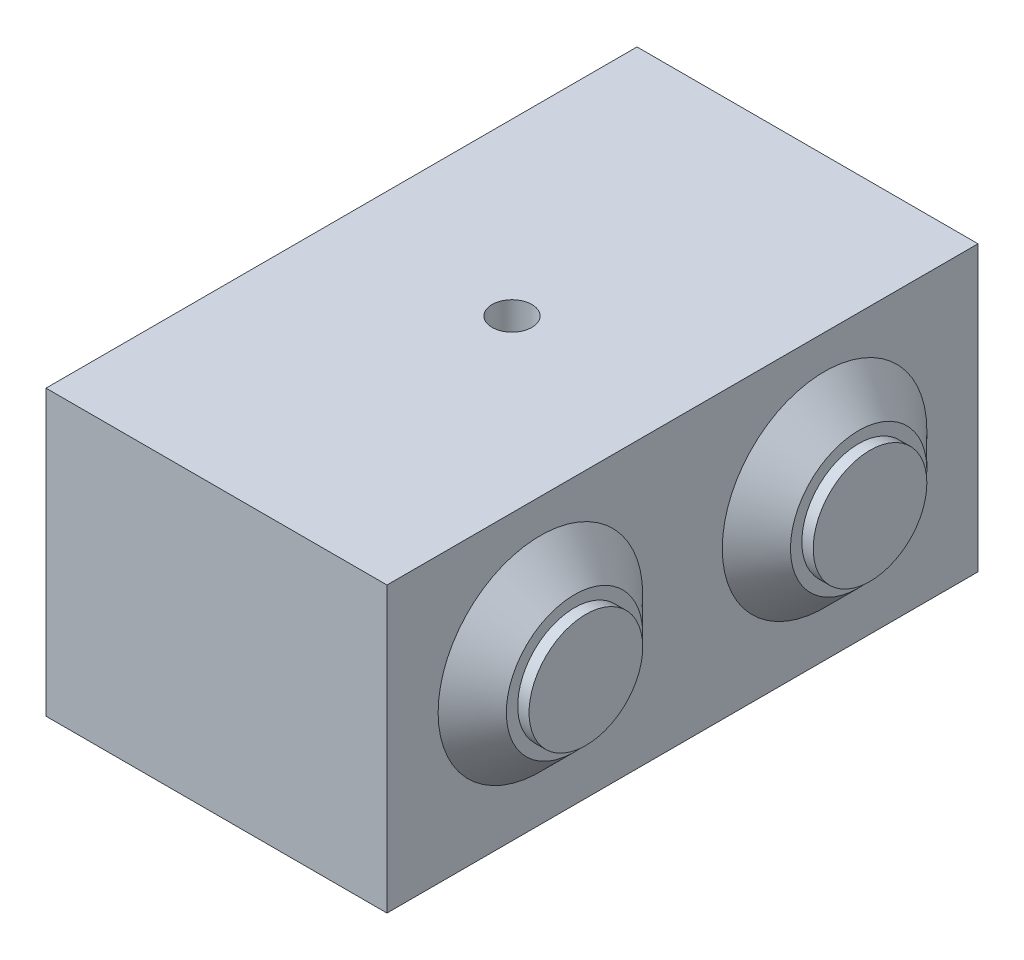
from build123d import *

# Parameters (mm, degrees)
SKETCH1_W           = 30
SKETCH1_H           = 52
BOSS_EXTRUDE1_DEPTH = 25
SKETCH2_R           = 9
BOSS_EXTRUDE2_DEPTH = 3
CHAMFER1_SIZE       = 3
SKETCH3_R           = 5
BOSS_EXTRUDE3_DEPTH = 1
SKETCH4_R           = 1.75
CUT_EXTRUDE1_DEPTH  = 67.970142601


with BuildPart() as part:
    # Sketch1 → Boss-Extrude1 (new body)
    with BuildSketch(Plane(origin=(0, 0, 0), x_dir=(1, 0, 0), z_dir=(0, 1, 0))):
        with Locations((15, 26)):
            Rectangle(SKETCH1_W, SKETCH1_H)
    extrude(amount=BOSS_EXTRUDE1_DEPTH)

    # Sketch2 → Boss-Extrude2 (add)
    with BuildSketch(Plane(origin=(30, 0, 0), x_dir=(0, 0, -1), z_dir=(1, 0, 0))):
        with Locations((13.5, 13.021886364)):
            Circle(SKETCH2_R)
        with Locations(Location((38.5, 13.021886364, 0), (0, 0, 180))):
            Circle(SKETCH2_R)
    extrude(amount=BOSS_EXTRUDE2_DEPTH)

    # Chamfer1
    chamfer1_edges = [part.edges().sort_by_distance(p)[0] for p in [
        (33, 13.021886364, -4.5),
        (33, 13.021886364, -47.5),
    ]]
    chamfer(chamfer1_edges, length=CHAMFER1_SIZE - 0.0001)  # a hair under: the kernel refuses the full size

    # Sketch3 → Boss-Extrude3 (add)
    with BuildSketch(Plane(origin=(33, 0, 0), x_dir=(0, 0, -1), z_dir=(1, 0, 0))):
        with Locations((38.5, 13.021886364)):
            Circle(SKETCH3_R)
        with Locations((13.5, 13.021886364)):
            Circle(SKETCH3_R)
    extrude(amount=BOSS_EXTRUDE3_DEPTH)

    # Sketch4 → Cut-Extrude1 (cut, through all)
    with BuildSketch(Plane.XZ):
        with Locations(Location((15, -26, 0), (0, 0, 270))):
            Circle(SKETCH4_R)
    extrude(amount=-CUT_EXTRUDE1_DEPTH, mode=Mode.SUBTRACT)


solid = part.part
